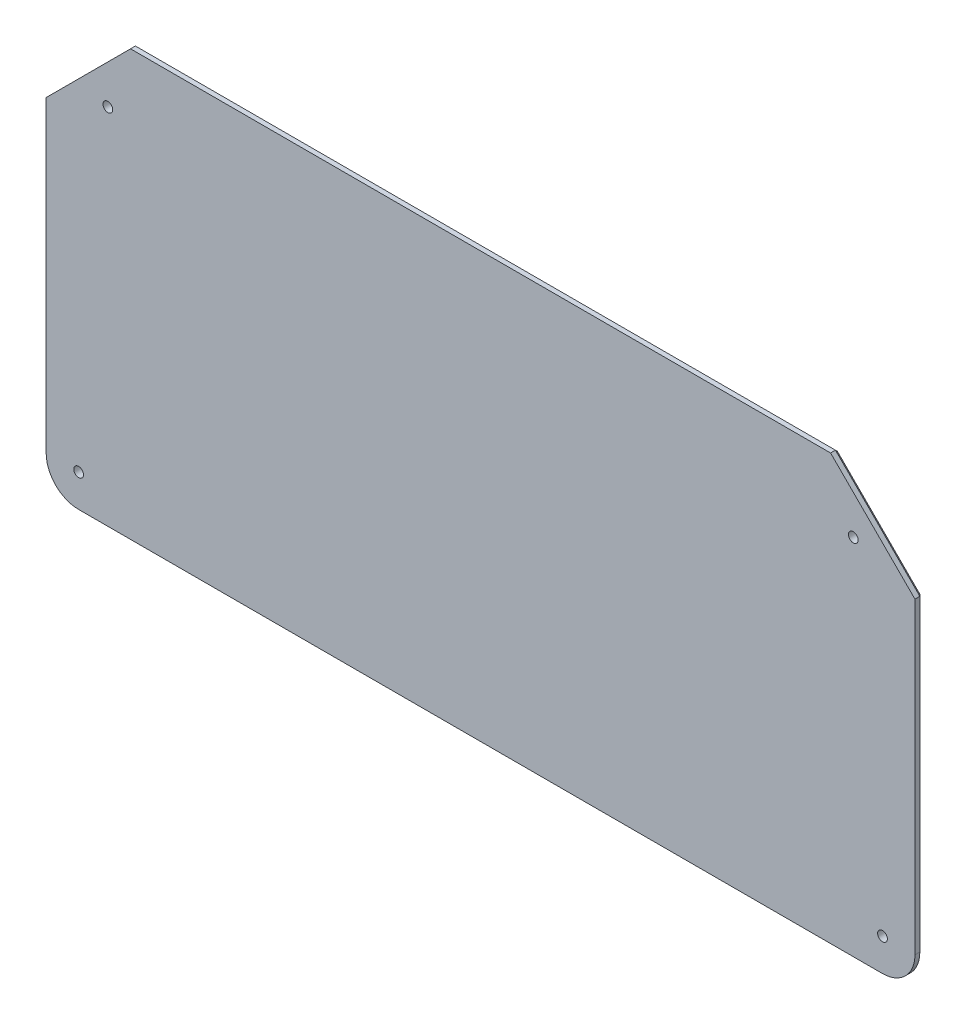
from build123d import *

# Parameters (mm, degrees)
BOSS_EXTRUDE1_DEPTH   = 2.5
F_3_0MM_DOWEL_HOLE1_D = 3
CHAMFER1_SIZE         = 1


with BuildPart() as part:
    # Sketch2 → Boss-Extrude1 (new body)
    with BuildSketch(Plane.XY):
        with BuildLine():
            Line((6.41186441, 110.238694526), (6.41186441, 15.286374556))
            ThreePointArc((6.41186441, 15.286374556), (9.340796598, 8.215306744), (16.41186441, 5.286374556))
            Line((16.41186441, 5.286374556), (264.168886442, 5.286374556))
            ThreePointArc((264.168886442, 5.286374556), (271.239954254, 8.215306744), (274.168886442, 15.286374556))
            Line((274.168886442, 15.286374556), (274.168886442, 110.238694526))
            Line((274.168886442, 110.238694526), (248.168886442, 136.238694526))
            Line((248.168886442, 136.238694526), (32.41186441, 136.238694526))
            Line((32.41186441, 136.238694526), (6.41186441, 110.238694526))
        make_face()
    extrude(amount=-BOSS_EXTRUDE1_DEPTH)

    # Ø3.0mm Dowel Hole1 (through all)
    with Locations(Plane.XY):
        with Locations((16.41186441, 15.286374556), (25.42227205, 117.228286886), (255.158478802, 117.228286886), (264.168886442, 15.286374556)):
            Hole(F_3_0MM_DOWEL_HOLE1_D / 2)

    # Chamfer1
    chamfer1_edges = [part.edges().sort_by_distance(p)[0] for p in [
        (6.41186441, 62.762534541, -2.5),
        (9.340796598, 8.215306744, -2.5),
        (140.290375426, 5.286374556, -2.5),
        (271.239954254, 8.215306744, -2.5),
        (19.41186441, 123.238694526, -2.5),
        (274.168886442, 62.762534541, -2.5),
        (261.168886442, 123.238694526, -2.5),
        (140.290375426, 136.238694526, -2.5),
    ]]
    chamfer(chamfer1_edges, length=CHAMFER1_SIZE)


solid = part.part
